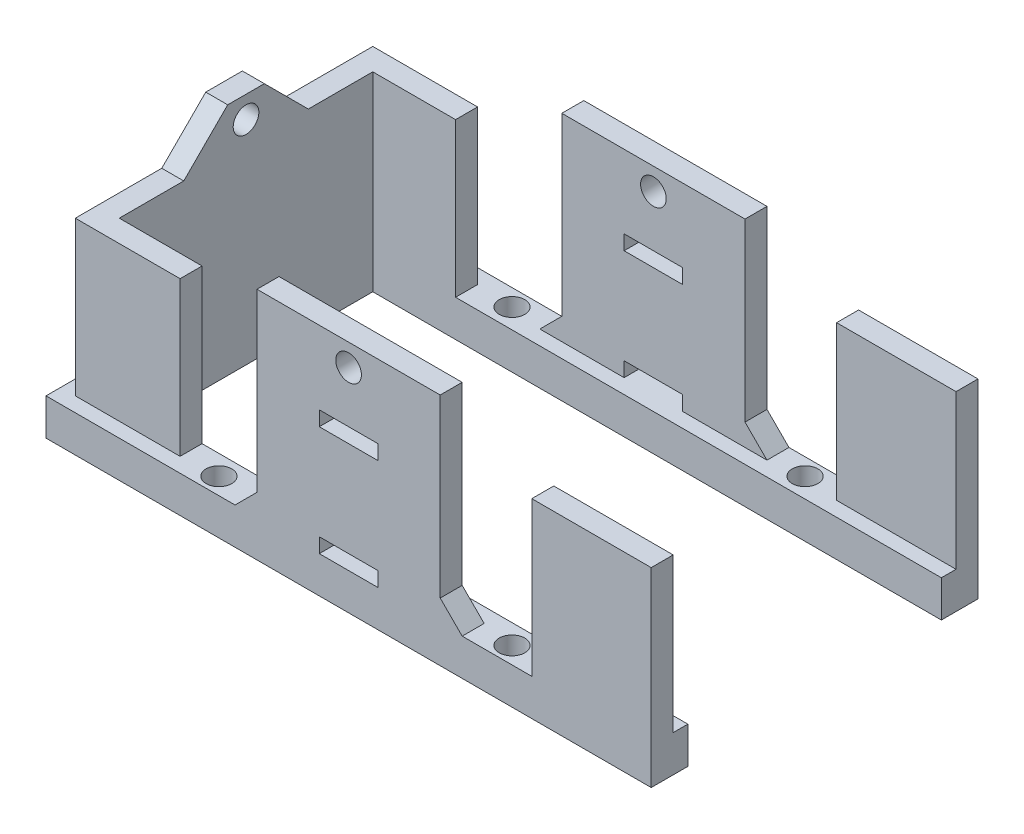
from build123d import *

# Parameters (mm, degrees)
CROQUIS1_R              = 1.75
SALIENTE_EXTRUIR1_DEPTH = 5
CROQUIS2_W              = 25
CROQUIS2_H              = 3
CROQUIS2_W_2            = 16.3
SALIENTE_EXTRUIR2_DEPTH = 21
CROQUIS4_W              = 3
CROQUIS4_H              = 5
SALIENTE_EXTRUIR3_DEPTH = 6
CROQUIS5_R              = 1.75
CORTAR_EXTRUIR2_DEPTH   = 90.541331239
CHAFL_N1_SIZE           = 6
CROQUIS6_W              = 25
CROQUIS6_H              = 3
SALIENTE_EXTRUIR4_DEPTH = 6
CROQUIS7_R              = 1.75
CROQUIS7_W              = 8
CROQUIS7_H              = 2
CORTAR_EXTRUIR3_DEPTH   = 69.693886191
CHAFL_N2_SIZE           = 3


with BuildPart() as part:
    # Croquis1 → Saliente-Extruir1 (new body)
    with BuildSketch(Plane(origin=(0, 0, 0), x_dir=(1, 0, 0), z_dir=(0, 1, 0))):
        Polygon((-36.3, 17.3), (36.3, 17.3), (41.3, 17.3), (41.3, 22.3), (-41.3, 22.3), (-41.3, -22.3), (41.3, -22.3), (41.3, -17.3), (36.3, -17.3), (-36.3, -17.3), align=None)
        with Locations(Location((-20, 20, 0), (0, 0, 270))):
            Circle(CROQUIS1_R, mode=Mode.SUBTRACT)
        with Locations(Location((20, 20, 0), (0, 0, 270))):
            Circle(CROQUIS1_R, mode=Mode.SUBTRACT)
        with Locations(Location((-20, -20, 0), (0, 0, 270))):
            Circle(CROQUIS1_R, mode=Mode.SUBTRACT)
        with Locations(Location((20, -20, 0), (0, 0, 270))):
            Circle(CROQUIS1_R, mode=Mode.SUBTRACT)
    extrude(amount=SALIENTE_EXTRUIR1_DEPTH)

    # Croquis2 → Saliente-Extruir2 (add)
    with BuildSketch(Plane(origin=(0, 5, 0), x_dir=(1, 0, 0), z_dir=(0, 1, 0))):
        Polygon((-39.3, 20.3), (-39.3, -20.3), (-25, -20.3), (-25, -17.3), (-36.3, -17.3), (-36.3, 17.3), (-25, 17.3), (-25, 20.3), align=None)
        with Locations((0, -20.8)):
            Rectangle(CROQUIS2_W, CROQUIS2_H)
        with Locations((0, 20.8)):
            Rectangle(CROQUIS2_W, CROQUIS2_H)
        with Locations((33.15, -20.8)):
            Rectangle(CROQUIS2_W_2, CROQUIS2_H)
        with Locations((33.15, 20.8)):
            Rectangle(CROQUIS2_W_2, CROQUIS2_H)
    extrude(amount=SALIENTE_EXTRUIR2_DEPTH)

    # Croquis4 → Saliente-Extruir3 (add)
    with BuildSketch(Plane(origin=(0, 26, 0), x_dir=(1, 0, 0), z_dir=(0, 1, 0))):
        with Locations((-37.8, 0)):
            Rectangle(CROQUIS4_W, CROQUIS4_H)
    extrude(amount=SALIENTE_EXTRUIR3_DEPTH)

    # Croquis5 → Cortar-Extruir2 (cut, through all)
    with BuildSketch(Plane.ZY.offset(39.3)):
        with Locations((0, 29)):
            Circle(CROQUIS5_R)
    extrude(amount=-CORTAR_EXTRUIR2_DEPTH, mode=Mode.SUBTRACT)

    # Chaflán1
    chafl_n1_edges = [part.edges().sort_by_distance(p)[0] for p in [
        (-37.8, 26, 2.5),
        (-37.8, 26, -2.5),
    ]]
    chamfer(chafl_n1_edges, length=CHAFL_N1_SIZE - 0.0001)  # a hair under: the kernel refuses the full size

    # Croquis6 → Saliente-Extruir4 (add)
    with BuildSketch(Plane(origin=(0, 26, 0), x_dir=(1, 0, 0), z_dir=(0, 1, 0))):
        with Locations((0, 20.8)):
            Rectangle(CROQUIS6_W, CROQUIS6_H)
        with Locations((0, -20.8)):
            Rectangle(CROQUIS6_W, CROQUIS6_H)
    extrude(amount=SALIENTE_EXTRUIR4_DEPTH)

    # Croquis7 → Cortar-Extruir3 (cut, through all)
    with BuildSketch(Plane(origin=(0, 0, -22.3), x_dir=(-1, 0, 0), z_dir=(0, 0, -1))):
        with Locations((0, 29)):
            Circle(CROQUIS7_R)
        with Locations((0, 21)):
            Rectangle(CROQUIS7_W, CROQUIS7_H)
        with Locations((0, 6)):
            Rectangle(CROQUIS7_W, CROQUIS7_H)
    extrude(amount=-CORTAR_EXTRUIR3_DEPTH, mode=Mode.SUBTRACT)

    # Chaflán2
    chafl_n2_edges = [part.edges().sort_by_distance(p)[0] for p in [
        (-12.5, 5, 20.8),
        (12.5, 5, 20.8),
        (-12.5, 5, -20.8),
        (12.5, 5, -20.8),
    ]]
    chamfer(chafl_n2_edges, length=CHAFL_N2_SIZE)


solid = part.part
